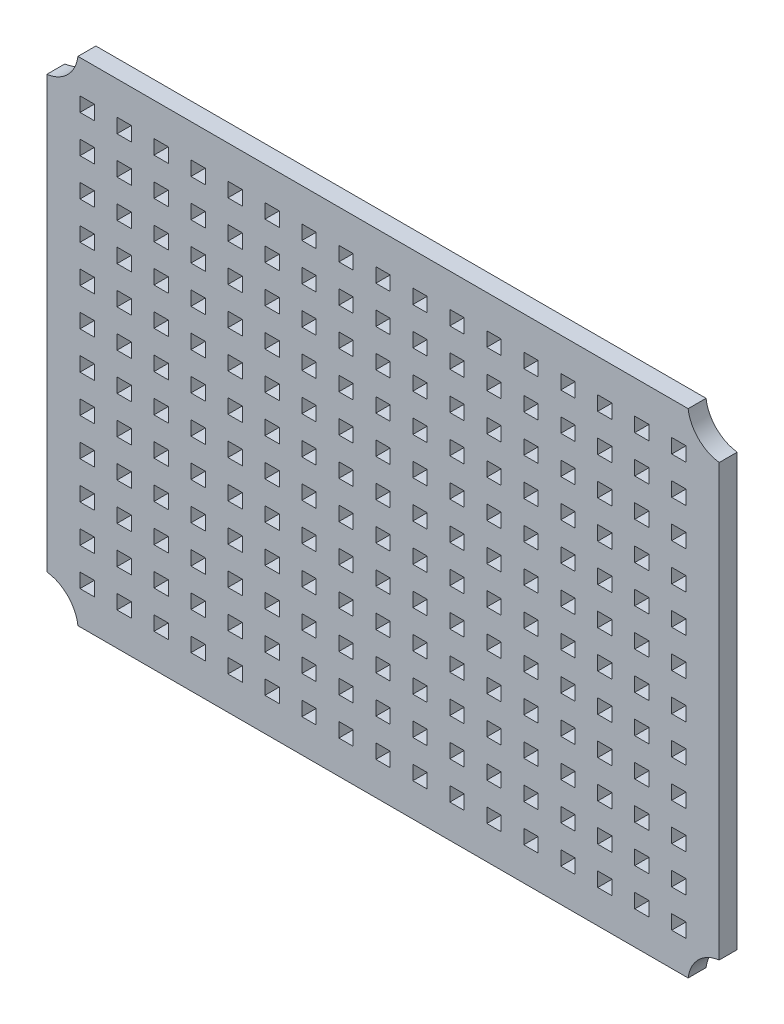
from build123d import *

# Parameters (mm, degrees)
RESSALTO_EXTRUS_O1_DEPTH = 5
ESBO_O3_W                = 4
ESBO_O3_H                = 4
CORTE_EXTRUS_O1_DEPTH    = 5
ESBO_O4_W                = 354.751411718
ESBO_O4_H                = 2.5
CORTE_EXTRUS_O2_DEPTH    = 5
ESBO_O5_W                = 359.338090262
ESBO_O5_H                = 2.5
CORTE_EXTRUS_O3_DEPTH    = 5
ESBO_O6_W                = 2.5
ESBO_O6_H                = 263.37957126
ESBO_O6_H_2              = 258.792892716
CORTE_EXTRUS_O4_DEPTH    = 5


with BuildPart() as part:
    # Esboço1 → Ressalto-extrusão1 (new body)
    with BuildSketch(Plane.XY):
        with BuildLine():
            Line((-85, 70), (85, 70))
            ThreePointArc((85, 70), (87.928932188, 62.928932188), (95, 60))
            Line((95, 60), (95, -60))
            ThreePointArc((95, -60), (87.928932188, -62.928932188), (85, -70))
            Line((85, -70), (-85, -70))
            ThreePointArc((-85, -70), (-87.928932188, -62.928932188), (-95, -60))
            Line((-95, -60), (-95, 60))
            ThreePointArc((-95, 60), (-87.928932188, 62.928932188), (-85, 70))
        make_face()
    extrude(amount=RESSALTO_EXTRUS_O1_DEPTH)

    # Esboço3 → Corte-extrusão1 (cut)
    with BuildSketch(Plane.XY.offset(5)):
        with Locations((-72.1875, 57.5)):
            Rectangle(ESBO_O3_W, ESBO_O3_H)
        with Locations((-82.5, 57.5)):
            Rectangle(ESBO_O3_W, ESBO_O3_H)
        with Locations((-61.875, 57.5)):
            Rectangle(ESBO_O3_W, ESBO_O3_H)
        with Locations((-51.5625, 57.5)):
            Rectangle(ESBO_O3_W, ESBO_O3_H)
        with Locations((-41.25, 57.5)):
            Rectangle(ESBO_O3_W, ESBO_O3_H)
        with Locations((-30.9375, 57.5)):
            Rectangle(ESBO_O3_W, ESBO_O3_H)
        with Locations((-20.625, 57.5)):
            Rectangle(ESBO_O3_W, ESBO_O3_H)
        with Locations((-10.3125, 57.5)):
            Rectangle(ESBO_O3_W, ESBO_O3_H)
        with Locations((0, 57.5)):
            Rectangle(ESBO_O3_W, ESBO_O3_H)
        with Locations((10.3125, 57.5)):
            Rectangle(ESBO_O3_W, ESBO_O3_H)
        with Locations((20.625, 57.5)):
            Rectangle(ESBO_O3_W, ESBO_O3_H)
        with Locations((30.9375, 57.5)):
            Rectangle(ESBO_O3_W, ESBO_O3_H)
        with Locations((41.25, 57.5)):
            Rectangle(ESBO_O3_W, ESBO_O3_H)
        with Locations((51.5625, 57.5)):
            Rectangle(ESBO_O3_W, ESBO_O3_H)
        with Locations((61.875, 57.5)):
            Rectangle(ESBO_O3_W, ESBO_O3_H)
        with Locations((72.1875, 57.5)):
            Rectangle(ESBO_O3_W, ESBO_O3_H)
        with Locations((82.5, 57.5)):
            Rectangle(ESBO_O3_W, ESBO_O3_H)
        with Locations((-72.1875, 47.0455)):
            Rectangle(ESBO_O3_W, ESBO_O3_H)
        with Locations((-61.875, 47.0455)):
            Rectangle(ESBO_O3_W, ESBO_O3_H)
        with Locations((-51.5625, 47.0455)):
            Rectangle(ESBO_O3_W, ESBO_O3_H)
        with Locations((-41.25, 47.0455)):
            Rectangle(ESBO_O3_W, ESBO_O3_H)
        with Locations((-30.9375, 47.0455)):
            Rectangle(ESBO_O3_W, ESBO_O3_H)
        with Locations((-20.625, 47.0455)):
            Rectangle(ESBO_O3_W, ESBO_O3_H)
        with Locations((-10.3125, 47.0455)):
            Rectangle(ESBO_O3_W, ESBO_O3_H)
        with Locations((0, 47.0455)):
            Rectangle(ESBO_O3_W, ESBO_O3_H)
        with Locations((10.3125, 47.0455)):
            Rectangle(ESBO_O3_W, ESBO_O3_H)
        with Locations((20.625, 47.0455)):
            Rectangle(ESBO_O3_W, ESBO_O3_H)
        with Locations((30.9375, 47.0455)):
            Rectangle(ESBO_O3_W, ESBO_O3_H)
        with Locations((41.25, 47.0455)):
            Rectangle(ESBO_O3_W, ESBO_O3_H)
        with Locations((51.5625, 47.0455)):
            Rectangle(ESBO_O3_W, ESBO_O3_H)
        with Locations((61.875, 47.0455)):
            Rectangle(ESBO_O3_W, ESBO_O3_H)
        with Locations((72.1875, 47.0455)):
            Rectangle(ESBO_O3_W, ESBO_O3_H)
        with Locations((82.5, 47.0455)):
            Rectangle(ESBO_O3_W, ESBO_O3_H)
        with Locations((-72.1875, 36.591)):
            Rectangle(ESBO_O3_W, ESBO_O3_H)
        with Locations((-61.875, 36.591)):
            Rectangle(ESBO_O3_W, ESBO_O3_H)
        with Locations((-51.5625, 36.591)):
            Rectangle(ESBO_O3_W, ESBO_O3_H)
        with Locations((-41.25, 36.591)):
            Rectangle(ESBO_O3_W, ESBO_O3_H)
        with Locations((-30.9375, 36.591)):
            Rectangle(ESBO_O3_W, ESBO_O3_H)
        with Locations((-20.625, 36.591)):
            Rectangle(ESBO_O3_W, ESBO_O3_H)
        with Locations((-10.3125, 36.591)):
            Rectangle(ESBO_O3_W, ESBO_O3_H)
        with Locations((0, 36.591)):
            Rectangle(ESBO_O3_W, ESBO_O3_H)
        with Locations((10.3125, 36.591)):
            Rectangle(ESBO_O3_W, ESBO_O3_H)
        with Locations((20.625, 36.591)):
            Rectangle(ESBO_O3_W, ESBO_O3_H)
        with Locations((30.9375, 36.591)):
            Rectangle(ESBO_O3_W, ESBO_O3_H)
        with Locations((41.25, 36.591)):
            Rectangle(ESBO_O3_W, ESBO_O3_H)
        with Locations((51.5625, 36.591)):
            Rectangle(ESBO_O3_W, ESBO_O3_H)
        with Locations((61.875, 36.591)):
            Rectangle(ESBO_O3_W, ESBO_O3_H)
        with Locations((72.1875, 36.591)):
            Rectangle(ESBO_O3_W, ESBO_O3_H)
        with Locations((82.5, 36.591)):
            Rectangle(ESBO_O3_W, ESBO_O3_H)
        with Locations((-72.1875, 26.1365)):
            Rectangle(ESBO_O3_W, ESBO_O3_H)
        with Locations((-61.875, 26.1365)):
            Rectangle(ESBO_O3_W, ESBO_O3_H)
        with Locations((-51.5625, 26.1365)):
            Rectangle(ESBO_O3_W, ESBO_O3_H)
        with Locations((-41.25, 26.1365)):
            Rectangle(ESBO_O3_W, ESBO_O3_H)
        with Locations((-30.9375, 26.1365)):
            Rectangle(ESBO_O3_W, ESBO_O3_H)
        with Locations((-20.625, 26.1365)):
            Rectangle(ESBO_O3_W, ESBO_O3_H)
        with Locations((-10.3125, 26.1365)):
            Rectangle(ESBO_O3_W, ESBO_O3_H)
        with Locations((0, 26.1365)):
            Rectangle(ESBO_O3_W, ESBO_O3_H)
        with Locations((10.3125, 26.1365)):
            Rectangle(ESBO_O3_W, ESBO_O3_H)
        with Locations((20.625, 26.1365)):
            Rectangle(ESBO_O3_W, ESBO_O3_H)
        with Locations((30.9375, 26.1365)):
            Rectangle(ESBO_O3_W, ESBO_O3_H)
        with Locations((41.25, 26.1365)):
            Rectangle(ESBO_O3_W, ESBO_O3_H)
        with Locations((51.5625, 26.1365)):
            Rectangle(ESBO_O3_W, ESBO_O3_H)
        with Locations((61.875, 26.1365)):
            Rectangle(ESBO_O3_W, ESBO_O3_H)
        with Locations((72.1875, 26.1365)):
            Rectangle(ESBO_O3_W, ESBO_O3_H)
        with Locations((82.5, 26.1365)):
            Rectangle(ESBO_O3_W, ESBO_O3_H)
        with Locations((-72.1875, 15.682)):
            Rectangle(ESBO_O3_W, ESBO_O3_H)
        with Locations((-61.875, 15.682)):
            Rectangle(ESBO_O3_W, ESBO_O3_H)
        with Locations((-51.5625, 15.682)):
            Rectangle(ESBO_O3_W, ESBO_O3_H)
        with Locations((-41.25, 15.682)):
            Rectangle(ESBO_O3_W, ESBO_O3_H)
        with Locations((-30.9375, 15.682)):
            Rectangle(ESBO_O3_W, ESBO_O3_H)
        with Locations((-20.625, 15.682)):
            Rectangle(ESBO_O3_W, ESBO_O3_H)
        with Locations((-10.3125, 15.682)):
            Rectangle(ESBO_O3_W, ESBO_O3_H)
        with Locations((0, 15.682)):
            Rectangle(ESBO_O3_W, ESBO_O3_H)
        with Locations((10.3125, 15.682)):
            Rectangle(ESBO_O3_W, ESBO_O3_H)
        with Locations((20.625, 15.682)):
            Rectangle(ESBO_O3_W, ESBO_O3_H)
        with Locations((30.9375, 15.682)):
            Rectangle(ESBO_O3_W, ESBO_O3_H)
        with Locations((41.25, 15.682)):
            Rectangle(ESBO_O3_W, ESBO_O3_H)
        with Locations((51.5625, 15.682)):
            Rectangle(ESBO_O3_W, ESBO_O3_H)
        with Locations((61.875, 15.682)):
            Rectangle(ESBO_O3_W, ESBO_O3_H)
        with Locations((72.1875, 15.682)):
            Rectangle(ESBO_O3_W, ESBO_O3_H)
        with Locations((82.5, 15.682)):
            Rectangle(ESBO_O3_W, ESBO_O3_H)
        with Locations((-72.1875, 5.2275)):
            Rectangle(ESBO_O3_W, ESBO_O3_H)
        with Locations((-61.875, 5.2275)):
            Rectangle(ESBO_O3_W, ESBO_O3_H)
        with Locations((-51.5625, 5.2275)):
            Rectangle(ESBO_O3_W, ESBO_O3_H)
        with Locations((-41.25, 5.2275)):
            Rectangle(ESBO_O3_W, ESBO_O3_H)
        with Locations((-30.9375, 5.2275)):
            Rectangle(ESBO_O3_W, ESBO_O3_H)
        with Locations((-20.625, 5.2275)):
            Rectangle(ESBO_O3_W, ESBO_O3_H)
        with Locations((-10.3125, 5.2275)):
            Rectangle(ESBO_O3_W, ESBO_O3_H)
        with Locations((0, 5.2275)):
            Rectangle(ESBO_O3_W, ESBO_O3_H)
        with Locations((10.3125, 5.2275)):
            Rectangle(ESBO_O3_W, ESBO_O3_H)
        with Locations((20.625, 5.2275)):
            Rectangle(ESBO_O3_W, ESBO_O3_H)
        with Locations((30.9375, 5.2275)):
            Rectangle(ESBO_O3_W, ESBO_O3_H)
        with Locations((41.25, 5.2275)):
            Rectangle(ESBO_O3_W, ESBO_O3_H)
        with Locations((51.5625, 5.2275)):
            Rectangle(ESBO_O3_W, ESBO_O3_H)
        with Locations((61.875, 5.2275)):
            Rectangle(ESBO_O3_W, ESBO_O3_H)
        with Locations((72.1875, 5.2275)):
            Rectangle(ESBO_O3_W, ESBO_O3_H)
        with Locations((82.5, 5.2275)):
            Rectangle(ESBO_O3_W, ESBO_O3_H)
        with Locations((-72.1875, -5.227)):
            Rectangle(ESBO_O3_W, ESBO_O3_H)
        with Locations((-61.875, -5.227)):
            Rectangle(ESBO_O3_W, ESBO_O3_H)
        with Locations((-51.5625, -5.227)):
            Rectangle(ESBO_O3_W, ESBO_O3_H)
        with Locations((-41.25, -5.227)):
            Rectangle(ESBO_O3_W, ESBO_O3_H)
        with Locations((-30.9375, -5.227)):
            Rectangle(ESBO_O3_W, ESBO_O3_H)
        with Locations((-20.625, -5.227)):
            Rectangle(ESBO_O3_W, ESBO_O3_H)
        with Locations((-10.3125, -5.227)):
            Rectangle(ESBO_O3_W, ESBO_O3_H)
        with Locations((0, -5.227)):
            Rectangle(ESBO_O3_W, ESBO_O3_H)
        with Locations((10.3125, -5.227)):
            Rectangle(ESBO_O3_W, ESBO_O3_H)
        with Locations((20.625, -5.227)):
            Rectangle(ESBO_O3_W, ESBO_O3_H)
        with Locations((30.9375, -5.227)):
            Rectangle(ESBO_O3_W, ESBO_O3_H)
        with Locations((41.25, -5.227)):
            Rectangle(ESBO_O3_W, ESBO_O3_H)
        with Locations((51.5625, -5.227)):
            Rectangle(ESBO_O3_W, ESBO_O3_H)
        with Locations((61.875, -5.227)):
            Rectangle(ESBO_O3_W, ESBO_O3_H)
        with Locations((72.1875, -5.227)):
            Rectangle(ESBO_O3_W, ESBO_O3_H)
        with Locations((82.5, -5.227)):
            Rectangle(ESBO_O3_W, ESBO_O3_H)
        with Locations((-72.1875, -15.6815)):
            Rectangle(ESBO_O3_W, ESBO_O3_H)
        with Locations((-61.875, -15.6815)):
            Rectangle(ESBO_O3_W, ESBO_O3_H)
        with Locations((-51.5625, -15.6815)):
            Rectangle(ESBO_O3_W, ESBO_O3_H)
        with Locations((-41.25, -15.6815)):
            Rectangle(ESBO_O3_W, ESBO_O3_H)
        with Locations((-30.9375, -15.6815)):
            Rectangle(ESBO_O3_W, ESBO_O3_H)
        with Locations((-20.625, -15.6815)):
            Rectangle(ESBO_O3_W, ESBO_O3_H)
        with Locations((-10.3125, -15.6815)):
            Rectangle(ESBO_O3_W, ESBO_O3_H)
        with Locations((0, -15.6815)):
            Rectangle(ESBO_O3_W, ESBO_O3_H)
        with Locations((10.3125, -15.6815)):
            Rectangle(ESBO_O3_W, ESBO_O3_H)
        with Locations((20.625, -15.6815)):
            Rectangle(ESBO_O3_W, ESBO_O3_H)
        with Locations((30.9375, -15.6815)):
            Rectangle(ESBO_O3_W, ESBO_O3_H)
        with Locations((41.25, -15.6815)):
            Rectangle(ESBO_O3_W, ESBO_O3_H)
        with Locations((51.5625, -15.6815)):
            Rectangle(ESBO_O3_W, ESBO_O3_H)
        with Locations((61.875, -15.6815)):
            Rectangle(ESBO_O3_W, ESBO_O3_H)
        with Locations((72.1875, -15.6815)):
            Rectangle(ESBO_O3_W, ESBO_O3_H)
        with Locations((82.5, -15.6815)):
            Rectangle(ESBO_O3_W, ESBO_O3_H)
        with Locations((-72.1875, -26.136)):
            Rectangle(ESBO_O3_W, ESBO_O3_H)
        with Locations((-61.875, -26.136)):
            Rectangle(ESBO_O3_W, ESBO_O3_H)
        with Locations((-51.5625, -26.136)):
            Rectangle(ESBO_O3_W, ESBO_O3_H)
        with Locations((-41.25, -26.136)):
            Rectangle(ESBO_O3_W, ESBO_O3_H)
        with Locations((-30.9375, -26.136)):
            Rectangle(ESBO_O3_W, ESBO_O3_H)
        with Locations((-20.625, -26.136)):
            Rectangle(ESBO_O3_W, ESBO_O3_H)
        with Locations((-10.3125, -26.136)):
            Rectangle(ESBO_O3_W, ESBO_O3_H)
        with Locations((0, -26.136)):
            Rectangle(ESBO_O3_W, ESBO_O3_H)
        with Locations((10.3125, -26.136)):
            Rectangle(ESBO_O3_W, ESBO_O3_H)
        with Locations((20.625, -26.136)):
            Rectangle(ESBO_O3_W, ESBO_O3_H)
        with Locations((30.9375, -26.136)):
            Rectangle(ESBO_O3_W, ESBO_O3_H)
        with Locations((41.25, -26.136)):
            Rectangle(ESBO_O3_W, ESBO_O3_H)
        with Locations((51.5625, -26.136)):
            Rectangle(ESBO_O3_W, ESBO_O3_H)
        with Locations((61.875, -26.136)):
            Rectangle(ESBO_O3_W, ESBO_O3_H)
        with Locations((72.1875, -26.136)):
            Rectangle(ESBO_O3_W, ESBO_O3_H)
        with Locations((82.5, -26.136)):
            Rectangle(ESBO_O3_W, ESBO_O3_H)
        with Locations((-72.1875, -36.5905)):
            Rectangle(ESBO_O3_W, ESBO_O3_H)
        with Locations((-61.875, -36.5905)):
            Rectangle(ESBO_O3_W, ESBO_O3_H)
        with Locations((-51.5625, -36.5905)):
            Rectangle(ESBO_O3_W, ESBO_O3_H)
        with Locations((-41.25, -36.5905)):
            Rectangle(ESBO_O3_W, ESBO_O3_H)
        with Locations((-30.9375, -36.5905)):
            Rectangle(ESBO_O3_W, ESBO_O3_H)
        with Locations((-20.625, -36.5905)):
            Rectangle(ESBO_O3_W, ESBO_O3_H)
        with Locations((-10.3125, -36.5905)):
            Rectangle(ESBO_O3_W, ESBO_O3_H)
        with Locations((0, -36.5905)):
            Rectangle(ESBO_O3_W, ESBO_O3_H)
        with Locations((10.3125, -36.5905)):
            Rectangle(ESBO_O3_W, ESBO_O3_H)
        with Locations((20.625, -36.5905)):
            Rectangle(ESBO_O3_W, ESBO_O3_H)
        with Locations((30.9375, -36.5905)):
            Rectangle(ESBO_O3_W, ESBO_O3_H)
        with Locations((41.25, -36.5905)):
            Rectangle(ESBO_O3_W, ESBO_O3_H)
        with Locations((51.5625, -36.5905)):
            Rectangle(ESBO_O3_W, ESBO_O3_H)
        with Locations((61.875, -36.5905)):
            Rectangle(ESBO_O3_W, ESBO_O3_H)
        with Locations((72.1875, -36.5905)):
            Rectangle(ESBO_O3_W, ESBO_O3_H)
        with Locations((82.5, -36.5905)):
            Rectangle(ESBO_O3_W, ESBO_O3_H)
        with Locations((-72.1875, -47.045)):
            Rectangle(ESBO_O3_W, ESBO_O3_H)
        with Locations((-61.875, -47.045)):
            Rectangle(ESBO_O3_W, ESBO_O3_H)
        with Locations((-51.5625, -47.045)):
            Rectangle(ESBO_O3_W, ESBO_O3_H)
        with Locations((-41.25, -47.045)):
            Rectangle(ESBO_O3_W, ESBO_O3_H)
        with Locations((-30.9375, -47.045)):
            Rectangle(ESBO_O3_W, ESBO_O3_H)
        with Locations((-20.625, -47.045)):
            Rectangle(ESBO_O3_W, ESBO_O3_H)
        with Locations((-10.3125, -47.045)):
            Rectangle(ESBO_O3_W, ESBO_O3_H)
        with Locations((0, -47.045)):
            Rectangle(ESBO_O3_W, ESBO_O3_H)
        with Locations((10.3125, -47.045)):
            Rectangle(ESBO_O3_W, ESBO_O3_H)
        with Locations((20.625, -47.045)):
            Rectangle(ESBO_O3_W, ESBO_O3_H)
        with Locations((30.9375, -47.045)):
            Rectangle(ESBO_O3_W, ESBO_O3_H)
        with Locations((41.25, -47.045)):
            Rectangle(ESBO_O3_W, ESBO_O3_H)
        with Locations((51.5625, -47.045)):
            Rectangle(ESBO_O3_W, ESBO_O3_H)
        with Locations((61.875, -47.045)):
            Rectangle(ESBO_O3_W, ESBO_O3_H)
        with Locations((72.1875, -47.045)):
            Rectangle(ESBO_O3_W, ESBO_O3_H)
        with Locations((82.5, -47.045)):
            Rectangle(ESBO_O3_W, ESBO_O3_H)
        with Locations((-72.1875, -57.4995)):
            Rectangle(ESBO_O3_W, ESBO_O3_H)
        with Locations((-61.875, -57.4995)):
            Rectangle(ESBO_O3_W, ESBO_O3_H)
        with Locations((-51.5625, -57.4995)):
            Rectangle(ESBO_O3_W, ESBO_O3_H)
        with Locations((-41.25, -57.4995)):
            Rectangle(ESBO_O3_W, ESBO_O3_H)
        with Locations((-30.9375, -57.4995)):
            Rectangle(ESBO_O3_W, ESBO_O3_H)
        with Locations((-20.625, -57.4995)):
            Rectangle(ESBO_O3_W, ESBO_O3_H)
        with Locations((-10.3125, -57.4995)):
            Rectangle(ESBO_O3_W, ESBO_O3_H)
        with Locations((0, -57.4995)):
            Rectangle(ESBO_O3_W, ESBO_O3_H)
        with Locations((10.3125, -57.4995)):
            Rectangle(ESBO_O3_W, ESBO_O3_H)
        with Locations((20.625, -57.4995)):
            Rectangle(ESBO_O3_W, ESBO_O3_H)
        with Locations((30.9375, -57.4995)):
            Rectangle(ESBO_O3_W, ESBO_O3_H)
        with Locations((41.25, -57.4995)):
            Rectangle(ESBO_O3_W, ESBO_O3_H)
        with Locations((51.5625, -57.4995)):
            Rectangle(ESBO_O3_W, ESBO_O3_H)
        with Locations((61.875, -57.4995)):
            Rectangle(ESBO_O3_W, ESBO_O3_H)
        with Locations((72.1875, -57.4995)):
            Rectangle(ESBO_O3_W, ESBO_O3_H)
        with Locations((82.5, -57.4995)):
            Rectangle(ESBO_O3_W, ESBO_O3_H)
        with Locations((-82.5, 47.0455)):
            Rectangle(ESBO_O3_W, ESBO_O3_H)
        with Locations((-82.5, 36.591)):
            Rectangle(ESBO_O3_W, ESBO_O3_H)
        with Locations((-82.5, 26.1365)):
            Rectangle(ESBO_O3_W, ESBO_O3_H)
        with Locations((-82.5, 15.682)):
            Rectangle(ESBO_O3_W, ESBO_O3_H)
        with Locations((-82.5, 5.2275)):
            Rectangle(ESBO_O3_W, ESBO_O3_H)
        with Locations((-82.5, -5.227)):
            Rectangle(ESBO_O3_W, ESBO_O3_H)
        with Locations((-82.5, -15.6815)):
            Rectangle(ESBO_O3_W, ESBO_O3_H)
        with Locations((-82.5, -26.136)):
            Rectangle(ESBO_O3_W, ESBO_O3_H)
        with Locations((-82.5, -36.5905)):
            Rectangle(ESBO_O3_W, ESBO_O3_H)
        with Locations((-82.5, -47.045)):
            Rectangle(ESBO_O3_W, ESBO_O3_H)
        with Locations((-82.5, -57.4995)):
            Rectangle(ESBO_O3_W, ESBO_O3_H)
    extrude(amount=-CORTE_EXTRUS_O1_DEPTH, mode=Mode.SUBTRACT)

    # Esboço4 → Corte-extrusão2 (cut)
    with BuildSketch(Plane.XY):
        with Locations((-85, 70)):
            Rectangle(ESBO_O4_W, ESBO_O4_H)
    extrude(amount=CORTE_EXTRUS_O2_DEPTH, mode=Mode.SUBTRACT)

    # Esboço5 → Corte-extrusão3 (cut)
    with BuildSketch(Plane.XY.offset(5)):
        with Locations((-85, -70)):
            Rectangle(ESBO_O5_W, ESBO_O5_H)
    extrude(amount=-CORTE_EXTRUS_O3_DEPTH, mode=Mode.SUBTRACT)

    # Esboço6 → Corte-extrusão4 (cut)
    with BuildSketch(Plane.XY.offset(5)):
        with Locations((95, 60)):
            Rectangle(ESBO_O6_W, ESBO_O6_H)
        with Locations((-95, 60)):
            Rectangle(ESBO_O6_W, ESBO_O6_H_2)
    extrude(amount=-CORTE_EXTRUS_O4_DEPTH, mode=Mode.SUBTRACT)


solid = part.part
